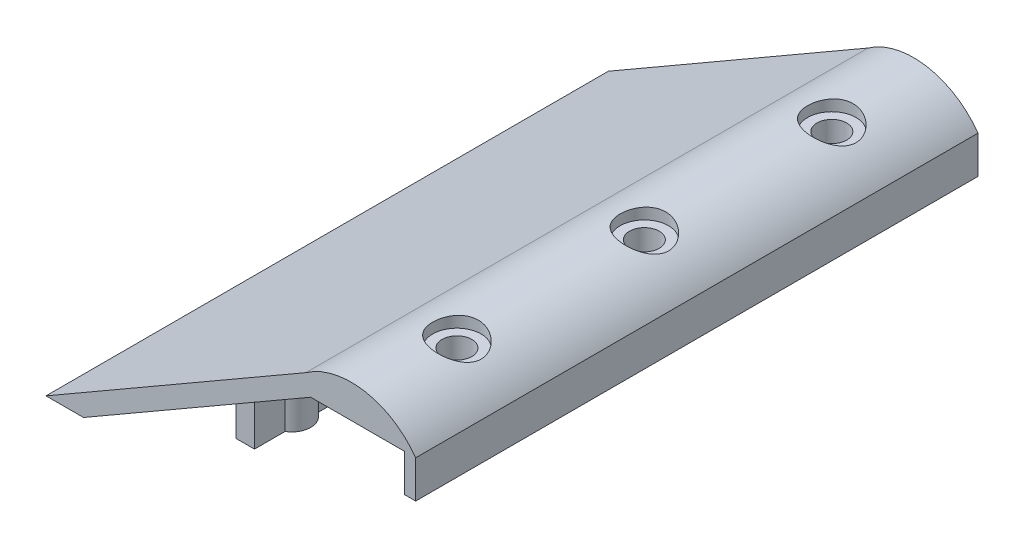
from build123d import *

# Parameters (mm, degrees)
SALIENTE_EXTRUIR1_DEPTH = 75
SALIENTE_EXTRUIR2_DEPTH = 17
CROQUIS3_R              = 3.96875
CORTAR_EXTRUIR1_DEPTH   = 10
CROQUIS4_R              = 6.46875
CROQUIS4_R_2            = 3.96875
CORTAR_EXTRUIR2_DEPTH   = 3


with BuildPart() as part:
    # Croquis1 → Saliente-Extruir1 (new, symmetric)
    with BuildSketch(Plane.XY):
        with BuildLine():
            Line((-60.621778265, -35), (0, 0))
            Line((0, 0), (25, 0))
            Line((25, 0), (25, -10))
            Line((25, -10), (28, -10))
            Line((28, -10), (28, 0))
            ThreePointArc((28, 0), (14.365660925, 8.576460347), (-1.339745962, 5))
            Line((-1.339745962, 5), (-70.621778265, -35))
            Line((-70.621778265, -35), (-60.621778265, -35))
        make_face()
    extrude(amount=SALIENTE_EXTRUIR1_DEPTH, both=True)

    # Croquis2 → Saliente-Extruir2 (add)
    with BuildSketch(Plane(origin=(0, -15, 0), x_dir=(1, 0, 0), z_dir=(0, 1, 0))):
        with BuildLine():
            Line((-32.5, 4.330127019), (-32.5, 12.5))
            Line((-32.5, 12.5), (-27.5, 12.5))
            Line((-27.5, 12.5), (-27.5, 4.330127019))
            ThreePointArc((-27.5, 4.330127019), (-25, 0), (-27.5, -4.330127019))
            Line((-27.5, -4.330127019), (-27.5, -12.5))
            Line((-27.5, -12.5), (-32.5, -12.5))
            Line((-32.5, -12.5), (-32.5, -4.330127019))
            ThreePointArc((-32.5, -4.330127019), (-35, 0), (-32.5, 4.330127019))
        make_face()
        with BuildLine():
            Line((-32.5, 54.330127019), (-32.5, 62.5))
            Line((-32.5, 62.5), (-27.5, 62.5))
            Line((-27.5, 62.5), (-27.5, 54.330127019))
            ThreePointArc((-27.5, 54.330127019), (-25, 50), (-27.5, 45.669872981))
            Line((-27.5, 45.669872981), (-27.5, 37.5))
            Line((-27.5, 37.5), (-32.5, 37.5))
            Line((-32.5, 37.5), (-32.5, 45.669872981))
            ThreePointArc((-32.5, 45.669872981), (-35, 50), (-32.5, 54.330127019))
        make_face()
        with BuildLine():
            Line((-32.5, -45.669872981), (-32.5, -37.5))
            Line((-32.5, -37.5), (-27.5, -37.5))
            Line((-27.5, -37.5), (-27.5, -45.669872981))
            ThreePointArc((-27.5, -45.669872981), (-25, -50), (-27.5, -54.330127019))
            Line((-27.5, -54.330127019), (-27.5, -62.5))
            Line((-27.5, -62.5), (-32.5, -62.5))
            Line((-32.5, -62.5), (-32.5, -54.330127019))
            ThreePointArc((-32.5, -54.330127019), (-35, -50), (-32.5, -45.669872981))
        make_face()
    extrude(amount=-SALIENTE_EXTRUIR2_DEPTH)

    # Croquis3 → Cortar-Extruir1 (cut)
    with BuildSketch(Plane(origin=(0, 8.875562309, 0), x_dir=(1, 0, 0), z_dir=(0, 1, 0))):
        with Locations((14, 0)):
            Circle(CROQUIS3_R)
        with Locations((14, 50)):
            Circle(CROQUIS3_R)
        with Locations((14, -50)):
            Circle(CROQUIS3_R)
    extrude(amount=-CORTAR_EXTRUIR1_DEPTH, mode=Mode.SUBTRACT)

    # Croquis4 → Cortar-Extruir2 (cut)
    # profile 1 of 3: a face of its own
    with BuildSketch(Plane(origin=(0, 8.875562309, 0), x_dir=(1, 0, 0), z_dir=(0, 1, 0))):
        with Locations((14, 50)):
            Circle(CROQUIS4_R)
        with Locations((14, 50)):
            Circle(CROQUIS4_R_2, mode=Mode.SUBTRACT)
    # profile 2 of 3: a face of its own
    with BuildSketch(Plane(origin=(0, 8.875562309, 0), x_dir=(1, 0, 0), z_dir=(0, 1, 0))):
        with Locations((14, 0)):
            Circle(CROQUIS4_R)
        with Locations((14, 0)):
            Circle(CROQUIS4_R_2, mode=Mode.SUBTRACT)
    # profile 3 of 3: a face of its own
    with BuildSketch(Plane(origin=(0, 8.875562309, 0), x_dir=(1, 0, 0), z_dir=(0, 1, 0))):
        with Locations((14, -50)):
            Circle(CROQUIS4_R)
        with Locations((14, -50)):
            Circle(CROQUIS4_R_2, mode=Mode.SUBTRACT)
    extrude(amount=-CORTAR_EXTRUIR2_DEPTH, mode=Mode.SUBTRACT)


solid = part.part
